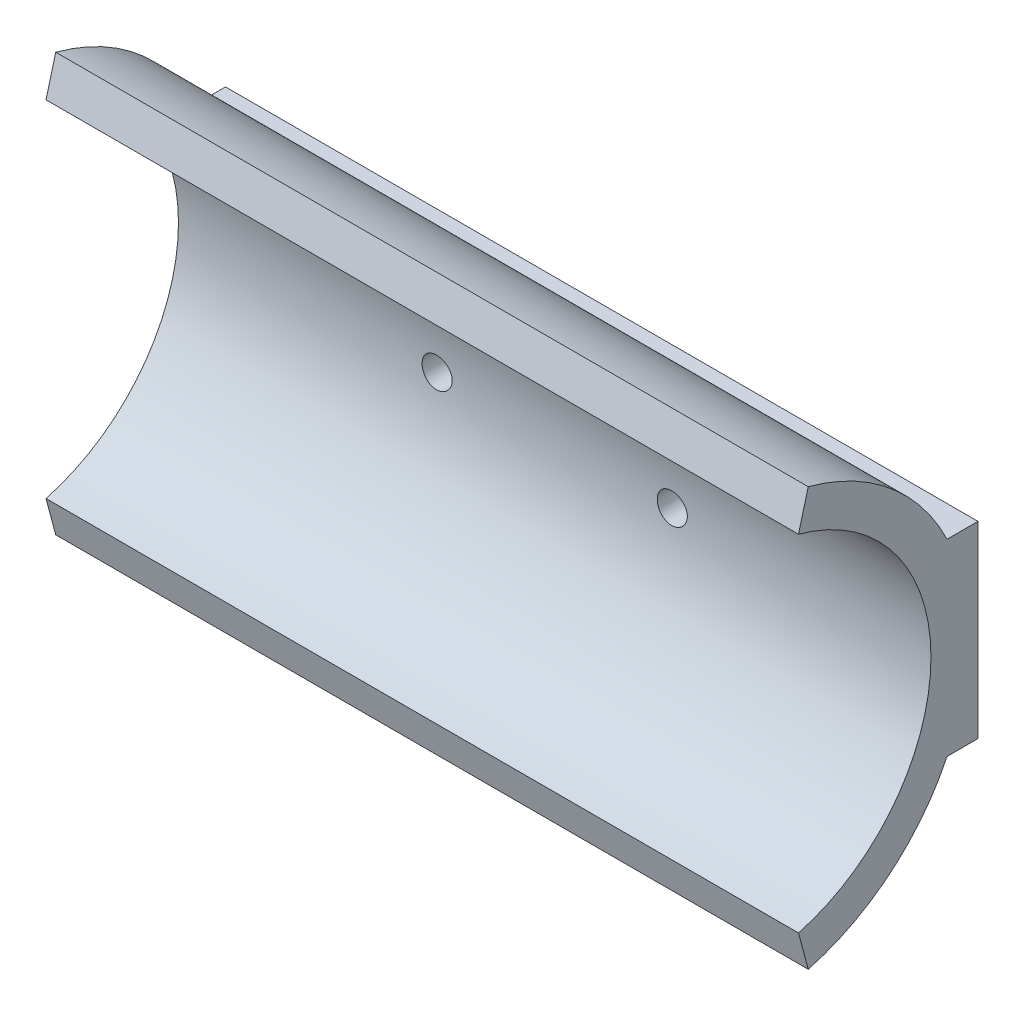
from build123d import *

# Parameters (mm, degrees)
BOSS_EXTRUDE1_DEPTH     = 40
CUT_EXTRUDE1_DEPTH      = 50.57522733
CUT_EXTRUDE1_DEPTH_BACK = 50.57522733
SKETCH2_R               = 1.6


with BuildPart() as part:
    # Sketch1 → Boss-Extrude1 (new, symmetric)
    with BuildSketch(Plane.YZ):
        with BuildLine():
            Line((18.352590699, -4.917561857), (22.216294005, -5.952838037))
            ThreePointArc((22.216294005, -5.952838037), (17.718152872, -14.665164806), (10, -20.712315177))
            Line((10, -20.712315177), (10, -24))
            Line((10, -24), (-10, -24))
            Line((-10, -24), (-10, -20.712315177))
            ThreePointArc((-10, -20.712315177), (-17.718152872, -14.665164806), (-22.216294005, -5.952838037))
            Line((-22.216294005, -5.952838037), (-18.352590699, -4.917561857))
            ThreePointArc((-18.352590699, -4.917561857), (0, -19), (18.352590699, -4.917561857))
        make_face()
    extrude(amount=BOSS_EXTRUDE1_DEPTH, both=True)

    # Sketch2 → Cut-Extrude1 (cut, two sides: drawn at the far end of the back side and taken through both)
    with BuildSketch(Plane(origin=(0, 0, -24), x_dir=(-1, 0, 0), z_dir=(0, 0, -1)).offset(-CUT_EXTRUDE1_DEPTH_BACK)):
        with Locations((12.5, 0)):
            Circle(SKETCH2_R)
        with Locations((-12.5, 0)):
            Circle(SKETCH2_R)
    extrude(amount=CUT_EXTRUDE1_DEPTH + CUT_EXTRUDE1_DEPTH_BACK, mode=Mode.SUBTRACT)


solid = part.part
